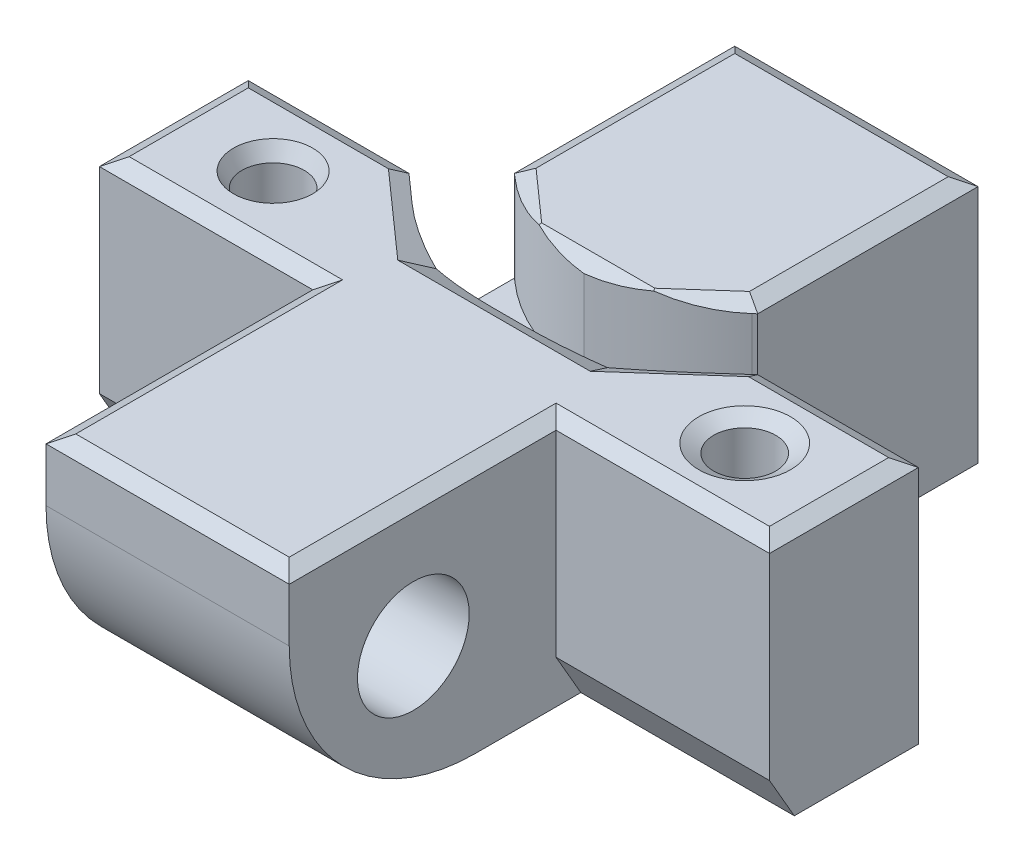
from build123d import *
from OCP.BRepFilletAPI import BRepFilletAPI_MakeChamfer

# Parameters (mm, degrees)
SKETCH_1_W          = 9.8
SKETCH_1_H          = 11
SKETCH_1_W_2        = 8.6
SKETCH_1_H_2        = 6
SKETCH_1_R          = 1.25
SKETCH_1_H_3        = 10.75
EXTRUDE_1_DEPTH     = 10
SKETCH_3_R          = 2.25
CUT_EXTRUDE_2_DEPTH = 26.121218621
CUT_EXTRUDE_3_DEPTH = 4
FILLET_2_R          = 7.5
CHAMFER_1_SIZE      = 0.6
CHAMFER_1_SIZE2     = 0.346410162
FILLET_3_R          = 8
CHAMFER_3_SIZE      = 1
CHAMFER_3_SIZE2     = 1.732050808


with BuildPart() as part:
    # ｽｹｯﾁ1 → ﾎﾞｽ - 押し出し1 (new body)
    # profile 1 of 5: a face of its own
    with BuildSketch(Plane(origin=(0, 0, 0), x_dir=(1, 0, 0), z_dir=(0, 1, 0))):
        with Locations((0, 8.375)):
            Rectangle(SKETCH_1_W, SKETCH_1_H)
    # profile 2 of 5: a face of its own
    with BuildSketch(Plane(origin=(0, 0, 0), x_dir=(1, 0, 0), z_dir=(0, 1, 0))):
        with Locations((9.2, -0.125)):
            Rectangle(SKETCH_1_W_2, SKETCH_1_H_2)
        with Locations(Location((9.5, -0.125, 0), (0, 0, 270))):
            Circle(SKETCH_1_R, mode=Mode.SUBTRACT)
    # profile 3 of 5: a face of its own
    with BuildSketch(Plane(origin=(0, 0, 0), x_dir=(1, 0, 0), z_dir=(0, 1, 0))):
        with Locations((0, -0.125)):
            Rectangle(SKETCH_1_W, SKETCH_1_H_2)
    # profile 4 of 5: a face of its own
    with BuildSketch(Plane(origin=(0, 0, 0), x_dir=(1, 0, 0), z_dir=(0, 1, 0))):
        with Locations((-9.2, -0.125)):
            Rectangle(SKETCH_1_W_2, SKETCH_1_H_2)
        with Locations(Location((-9.5, -0.125, 0), (0, 0, 270))):
            Circle(SKETCH_1_R, mode=Mode.SUBTRACT)
    # profile 5 of 5: a face of its own
    with BuildSketch(Plane(origin=(0, 0, 0), x_dir=(1, 0, 0), z_dir=(0, 1, 0))):
        with Locations((0, -8.5)):
            Rectangle(SKETCH_1_W, SKETCH_1_H_3)
    extrude(amount=EXTRUDE_1_DEPTH)

    # ｽｹｯﾁ3 → ｶｯﾄ - 押し出し2 (cut, through all)
    with BuildSketch(Plane(origin=(4.9, 0, 0), x_dir=(0, 0, -1), z_dir=(1, 0, 0))):
        with Locations((-8.875, 5)):
            Circle(SKETCH_3_R)
    extrude(amount=-CUT_EXTRUDE_2_DEPTH, mode=Mode.SUBTRACT)

    # ｽｹｯﾁ5 → ｶｯﾄ - 押し出し3 (cut)
    with BuildSketch(Plane(origin=(0, 10, 0), x_dir=(1, 0, 0), z_dir=(0, 1, 0))):
        Polygon((4.9, 5), (2.508885395, 2.875), (-2.508885395, 2.875), (-4.9, 5), (-4.9, 2.875), (-7.025, 2.875), (-3.649308793, -0.125), (3.649308793, -0.125), (7.025, 2.875), (4.9, 2.875), align=None)
    extrude(amount=-CUT_EXTRUDE_3_DEPTH, mode=Mode.SUBTRACT)

    # ﾌｨﾚｯﾄ2
    fillet_2_edges = [part.edges().sort_by_distance(p)[0] for p in [
        (0, 0, 13.875),
    ]]
    fillet(fillet_2_edges, radius=FILLET_2_R)

    # 面取り1: one chamfer whose edges measure the first distance from different faces: ONE call of the kernel's chamfer builder (chamfer() names one face for all edges)
    chamfer_1_edges_1 = [part.edges().sort_by_distance(p)[0] for p in [
        (-10.2625, 10, -2.875),
        (-13.5, 10, 0.125),
        (-9.2, 10, 3.125),
        (-4.9, 10, 8.5),
        (0, 10, 13.875),
        (4.9, 10, 8.5),
        (9.2, 10, 3.125),
        (13.5, 10, 0.125),
        (10.2625, 10, -2.875),
        (-5.337154396, 10, -1.375),
        (0, 10, 0.125),
        (5.337154396, 10, -1.375),
        (9.5, 10, -1.125),
    ]]
    chamfer_1_side_1 = [part.faces().sort_by_distance(p)[0] for p in [
        (0, 10, 4.272957296),
    ]]
    chamfer_1_edges_2 = [part.edges().sort_by_distance(p)[0] for p in [
        (-4.9, 10, -9.4375),
        (4.9, 10, -9.4375),
        (0, 10, -13.875),
        (3.704442697, 10, -3.9375),
        (0, 10, -2.875),
        (-3.704442697, 10, -3.9375),
    ]]
    chamfer_1_side_2 = [part.faces().sort_by_distance(p)[0] for p in [
        (0, 10, -8.612025812),
    ]]
    chamfer_1_edges_3 = [part.edges().sort_by_distance(p)[0] for p in [
        (-9.5, 10, -1.125),
    ]]
    chamfer_1_side_3 = [part.faces().sort_by_distance(p)[0] for p in [
        (-9.5, 5, -1.125),
    ]]
    chamfer_1 = BRepFilletAPI_MakeChamfer(part.part.solid().wrapped)
    for e in chamfer_1_edges_1:
        chamfer_1.Add(CHAMFER_1_SIZE, CHAMFER_1_SIZE2, e.wrapped, chamfer_1_side_1[0].wrapped)  # the first distance lies on this face
    for e in chamfer_1_edges_2:
        chamfer_1.Add(CHAMFER_1_SIZE, CHAMFER_1_SIZE2, e.wrapped, chamfer_1_side_2[0].wrapped)  # the first distance lies on this face
    for e in chamfer_1_edges_3:
        chamfer_1.Add(CHAMFER_1_SIZE, CHAMFER_1_SIZE2, e.wrapped, chamfer_1_side_3[0].wrapped)  # the first distance lies on this face
    add(Compound.cast(chamfer_1.Shape()), mode=Mode.REPLACE)

    # ﾌｨﾚｯﾄ3
    # the kernel refuses this fillet: 8 mm, written as the material it adds along each edge
    with BuildSketch(Plane(origin=(-3.649308793, 17.256412491, 0.125), x_dir=(-0.7474768694815634, 0, -0.6642878364007891), z_dir=(0, -1, 0))) as fillet_3_piece_1_section:
        with BuildLine():
            CenterArc((FILLET_3_R * 0.380141132625, FILLET_3_R), FILLET_3_R, 228.372286683, 41.627713317)
            Line((-FILLET_3_R * 0.284146703776, FILLET_3_R * 0.252523130518), (0, 0))
            Line((0, 0), (FILLET_3_R * 0.380141132625, 0))
        make_face()
    fillet_3_piece_1 = extrude(amount=11.256412491, mode=Mode.PRIVATE)
    fillet_3_piece_1 = split(fillet_3_piece_1, bisect_by=Plane(origin=(-2.381035156, 9.533713371, -0.082632133), z_dir=(0, -0.8660254037844377, 0.5000000000000018)), keep=Keep.TOP, mode=Mode.PRIVATE)
    add(fillet_3_piece_1)
    with BuildSketch(Plane(origin=(-3.649308793, 17.256412491, 0.125), x_dir=(-0.7474768694815634, 0, -0.6642878364007891), z_dir=(0, -1, 0))) as fillet_3_piece_2_section:
        with BuildLine():
            CenterArc((FILLET_3_R * 0.380141132625, FILLET_3_R), FILLET_3_R, 228.372286683, 41.627713317)
            Line((-FILLET_3_R * 0.284146703776, FILLET_3_R * 0.252523130518), (0, 0))
            Line((0, 0), (FILLET_3_R * 0.380141132625, 0))
        make_face()
    fillet_3_piece_2 = extrude(amount=11.256412491, mode=Mode.PRIVATE)
    fillet_3_piece_2 = split(fillet_3_piece_2, bisect_by=Plane(origin=(-4.4593865, 9.533713371, -0.872698967), z_dir=(-0.3321439182003959, -0.8660254037844376, 0.37373843474078333)), keep=Keep.TOP, mode=Mode.PRIVATE)
    add(fillet_3_piece_2)
    with BuildSketch(Plane(origin=(3.649308793, 17.256412491, 0.125), x_dir=(0.7474768694815636, 0, -0.6642878364007891), z_dir=(0, -1, 0))) as fillet_3_piece_3_section:
        with BuildLine():
            CenterArc((FILLET_3_R * 0.380141132625, -FILLET_3_R), FILLET_3_R, 90, 41.627713317)
            Line((-FILLET_3_R * 0.284146703776, -FILLET_3_R * 0.252523130518), (0, 0))
            Line((0, 0), (FILLET_3_R * 0.380141132625, 0))
        make_face()
    fillet_3_piece_3 = extrude(amount=11.256412491, mode=Mode.PRIVATE)
    fillet_3_piece_3 = split(fillet_3_piece_3, bisect_by=Plane(origin=(2.381035156, 9.533713371, -0.082632133), z_dir=(0, -0.8660254037844377, 0.5000000000000018)), keep=Keep.TOP, mode=Mode.PRIVATE)
    add(fillet_3_piece_3)
    with BuildSketch(Plane(origin=(3.649308793, 17.256412491, 0.125), x_dir=(0.7474768694815636, 0, -0.6642878364007891), z_dir=(0, -1, 0))) as fillet_3_piece_4_section:
        with BuildLine():
            CenterArc((FILLET_3_R * 0.380141132625, -FILLET_3_R), FILLET_3_R, 90, 41.627713317)
            Line((-FILLET_3_R * 0.284146703776, -FILLET_3_R * 0.252523130518), (0, 0))
            Line((0, 0), (FILLET_3_R * 0.380141132625, 0))
        make_face()
    fillet_3_piece_4 = extrude(amount=11.256412491, mode=Mode.PRIVATE)
    fillet_3_piece_4 = split(fillet_3_piece_4, bisect_by=Plane(origin=(4.4593865, 9.533713371, -0.872698967), z_dir=(0.3321439182003956, -0.8660254037844377, 0.373738434740783)), keep=Keep.TOP, mode=Mode.PRIVATE)
    add(fillet_3_piece_4)
    # the kernel refuses this fillet: 8 mm, written as the material it takes off along each edge
    with BuildSketch(Plane(origin=(2.508885395, 17.256412491, -2.875), x_dir=(0.7474768694815637, 0, -0.664287836400789), z_dir=(0, -1, 0)), Plane(origin=(-2.508885395, 17.256412491, -2.875), x_dir=(1, 0, 0), z_dir=(0, -1, 0))) as fillet_3_2_piece_1:
        with BuildLine():
            CenterArc((FILLET_3_R * 0.380141132625, -FILLET_3_R), FILLET_3_R, 90, 41.627713317)
            Line((-FILLET_3_R * 0.284146703776, -FILLET_3_R * 0.252523130518), (0, 0))
            Line((0, 0), (FILLET_3_R * 0.380141132625, 0))
        make_face()
    extrude(amount=11.256412491, mode=Mode.SUBTRACT)

    # 面取り3
    chamfer_3_edges = [part.edges().sort_by_distance(p)[0] for p in [
        (9.2, 0, 3.125),
        (-9.2, 0, 3.125),
    ]]
    chamfer_3_side = [part.faces().sort_by_distance(p)[0] for p in [
        (0, 0, -2.510051578),
    ]]
    chamfer(chamfer_3_edges, length=CHAMFER_3_SIZE, length2=CHAMFER_3_SIZE2, reference=chamfer_3_side[0])


solid = part.part
